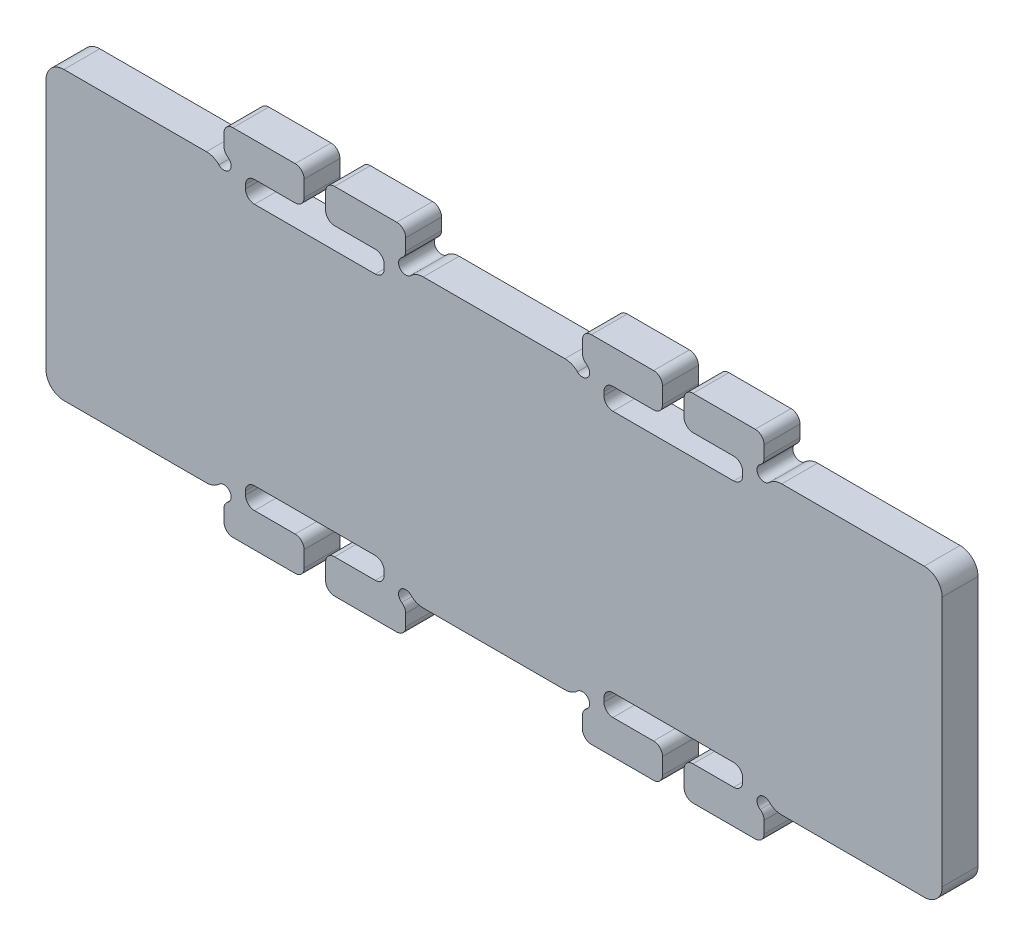
from build123d import *

# Parameters (mm, degrees)
SKETCH1_W            = 250
SKETCH1_H            = 80
BOSS_EXTRUDE1_DEPTH  = 10
BOSS_EXTRUDE2_DEPTH  = 10
SKETCH3_R            = 2
CUT_EXTRUDE1_DEPTH   = 266.725892604
FILLET1_R            = 2.5
FILLET1_OF_MIRROR1_R = 2.5
MIRROR3_DEPTH        = 10
MIRROR3_2_DEPTH      = 10
FILLET2_R            = 5


# Read off the part's stored shape, not the designer's step: Mirror3
with BuildPart() as part:
    # Sketch1 → Boss-Extrude1 (new body)
    with BuildSketch(Plane.XY):
        with Locations((125, 40)):
            Rectangle(SKETCH1_W, SKETCH1_H)
    extrude(amount=BOSS_EXTRUDE1_DEPTH)

    # Sketch2 → Boss-Extrude2 (add)
    with BuildSketch(Plane.XY.offset(10)):
        with BuildLine():
            Line((49.65, 80), (100.35, 80))
            Line((100.35, 80), (100.35, 87))
            ThreePointArc((100.35, 87), (99.617766953, 88.767766953), (97.85, 89.5))
            Line((97.85, 89.5), (52.15, 89.5))
            ThreePointArc((52.15, 89.5), (50.382233047, 88.767766953), (49.65, 87))
            Line((49.65, 87), (49.65, 80))
        make_face()
    boss_extrude2 = extrude(amount=-BOSS_EXTRUDE2_DEPTH)

    # Sketch3 → Cut-Extrude1 (cut, through all)
    with BuildSketch(Plane.XY.offset(10)):
        with Locations((49.65, 80)):
            Circle(SKETCH3_R)
        with Locations((100.35, 80)):
            Circle(SKETCH3_R)
        Polygon((55.65, 80), (72, 80), (72, 89.5), (78, 89.5), (78, 80), (94.35, 80), (94.35, 74), (55.65, 74), align=None)
    cut_extrude1 = extrude(amount=-CUT_EXTRUDE1_DEPTH, mode=Mode.SUBTRACT)

    # Fillet1
    fillet1_edges = [part.edges().sort_by_distance(p)[0] for p in [
        (49.65, 82, 5),
        (100.35, 82, 5),
        (55.65, 74, 5),
        (55.65, 80, 5),
        (72, 80, 5),
        (72, 89.5, 5),
        (78, 89.5, 5),
        (78, 80, 5),
        (94.35, 80, 5),
        (94.35, 74, 5),
    ]]
    fillet(fillet1_edges, radius=FILLET1_R)

    # Mirror1: Boss-Extrude2, Cut-Extrude1 across plane
    add(boss_extrude2.mirror(Plane.ZY.offset(-125)))
    add(cut_extrude1.mirror(Plane.ZY.offset(-125)), mode=Mode.SUBTRACT)

    # Fillet1 of Mirror1
    fillet1_of_mirror1_edges = [part.edges().sort_by_distance(p)[0] for p in [
        (200.35, 82, 5),
        (149.65, 82, 5),
        (194.35, 74, 5),
        (194.35, 80, 5),
        (178, 80, 5),
        (178, 89.5, 5),
        (172, 89.5, 5),
        (172, 80, 5),
        (155.65, 80, 5),
        (155.65, 74, 5),
    ]]
    fillet(fillet1_of_mirror1_edges, radius=FILLET1_OF_MIRROR1_R)

    # Mirror3 outline → Mirror3 (cut)
    with BuildSketch(Plane.XY):
        with BuildLine():
            Line((47.65, 0), (51.65, 0))
            ThreePointArc((51.65, 0), (49.65, 2), (47.65, 0))
        make_face()
        with BuildLine():
            ThreePointArc((202.35, 0), (200.35, 2), (198.35, 0))
            Line((198.35, 0), (202.35, 0))
        make_face()
        with BuildLine():
            ThreePointArc((151.65, 0), (149.65, 2), (147.65, 0))
            Line((147.65, 0), (151.65, 0))
        make_face()
        with BuildLine():
            ThreePointArc((102.35, 0), (100.35, 2), (98.35, 0))
            Line((98.35, 0), (102.35, 0))
        make_face()
        with BuildLine():
            ThreePointArc((55.65, 2.5), (56.382233047, 0.732233047), (58.15, 0))
            Line((58.15, 0), (91.85, 0))
            ThreePointArc((91.85, 0), (93.617766953, 0.732233047), (94.35, 2.5))
            Line((94.35, 2.5), (94.35, 3.5))
            ThreePointArc((94.35, 3.5), (93.617766953, 5.267766953), (91.85, 6))
            Line((91.85, 6), (58.15, 6))
            ThreePointArc((58.15, 6), (56.382233047, 5.267766953), (55.65, 3.5))
            Line((55.65, 3.5), (55.65, 2.5))
        make_face()
        with BuildLine():
            ThreePointArc((155.65, 2.5), (156.382233047, 0.732233047), (158.15, 0))
            Line((158.15, 0), (191.85, 0))
            ThreePointArc((191.85, 0), (193.617766953, 0.732233047), (194.35, 2.5))
            Line((194.35, 2.5), (194.35, 3.5))
            ThreePointArc((194.35, 3.5), (193.617766953, 5.267766953), (191.85, 6))
            Line((191.85, 6), (158.15, 6))
            ThreePointArc((158.15, 6), (156.382233047, 5.267766953), (155.65, 3.5))
            Line((155.65, 3.5), (155.65, 2.5))
        make_face()
    extrude(amount=MIRROR3_DEPTH, mode=Mode.SUBTRACT)

    # Mirror3 2 outline → Mirror3 2 (add)
    with BuildSketch(Plane.XY):
        with BuildLine():
            Line((169.5, 0), (151.65, 0))
            ThreePointArc((151.65, 0), (151.413834207, -0.942809042), (150.761111111, -1.662958839))
            ThreePointArc((150.761111111, -1.662958839), (149.945207241, -2.563146085), (149.65, -3.741657387))
            Line((149.65, -3.741657387), (149.65, -7))
            ThreePointArc((149.65, -7), (150.382233047, -8.767766953), (152.15, -9.5))
            Line((152.15, -9.5), (169.5, -9.5))
            ThreePointArc((169.5, -9.5), (171.267766953, -8.767766953), (172, -7))
            Line((172, -7), (172, -2.5))
            ThreePointArc((172, -2.5), (171.267766953, -0.732233047), (169.5, 0))
        make_face()
        with BuildLine():
            Line((49.65, -3.741657387), (49.65, -7))
            ThreePointArc((49.65, -7), (50.382233047, -8.767766953), (52.15, -9.5))
            Line((52.15, -9.5), (69.5, -9.5))
            ThreePointArc((69.5, -9.5), (71.267766953, -8.767766953), (72, -7))
            Line((72, -7), (72, -2.5))
            ThreePointArc((72, -2.5), (71.267766953, -0.732233047), (69.5, 0))
            Line((69.5, 0), (51.65, 0))
            ThreePointArc((51.65, 0), (51.413834207, -0.942809042), (50.761111111, -1.662958839))
            ThreePointArc((50.761111111, -1.662958839), (49.945207241, -2.563146085), (49.65, -3.741657387))
        make_face()
        with BuildLine():
            Line((98.35, 0), (80.5, 0))
            ThreePointArc((80.5, 0), (78.732233047, -0.732233047), (78, -2.5))
            Line((78, -2.5), (78, -7))
            ThreePointArc((78, -7), (78.732233047, -8.767766953), (80.5, -9.5))
            Line((80.5, -9.5), (97.85, -9.5))
            ThreePointArc((97.85, -9.5), (99.617766953, -8.767766953), (100.35, -7))
            Line((100.35, -7), (100.35, -3.741657387))
            ThreePointArc((100.35, -3.741657387), (100.054792759, -2.563146085), (99.238888889, -1.662958839))
            ThreePointArc((99.238888889, -1.662958839), (98.586165793, -0.942809042), (98.35, 0))
        make_face()
        with BuildLine():
            Line((198.35, 0), (180.5, 0))
            ThreePointArc((180.5, 0), (178.732233047, -0.732233047), (178, -2.5))
            Line((178, -2.5), (178, -7))
            ThreePointArc((178, -7), (178.732233047, -8.767766953), (180.5, -9.5))
            Line((180.5, -9.5), (197.85, -9.5))
            ThreePointArc((197.85, -9.5), (199.617766953, -8.767766953), (200.35, -7))
            Line((200.35, -7), (200.35, -3.741657387))
            ThreePointArc((200.35, -3.741657387), (200.054792759, -2.563146085), (199.238888889, -1.662958839))
            ThreePointArc((199.238888889, -1.662958839), (198.586165793, -0.942809042), (198.35, 0))
        make_face()
    extrude(amount=MIRROR3_2_DEPTH)

    # Fillet2
    fillet2_edges = [part.edges().sort_by_distance(p)[0] for p in [
        (202.35, 80, 5),
        (147.65, 80, 5),
        (202.35, 0, 5),
        (147.65, 0, 5),
        (47.65, 80, 5),
        (47.65, 0, 5),
        (102.35, 0, 5),
        (102.35, 80, 5),
        (0, 80, 5),
        (250, 80, 5),
        (250, 0, 5),
        (0, 0, 5),
    ]]
    fillet(fillet2_edges, radius=FILLET2_R)


solid = part.part
